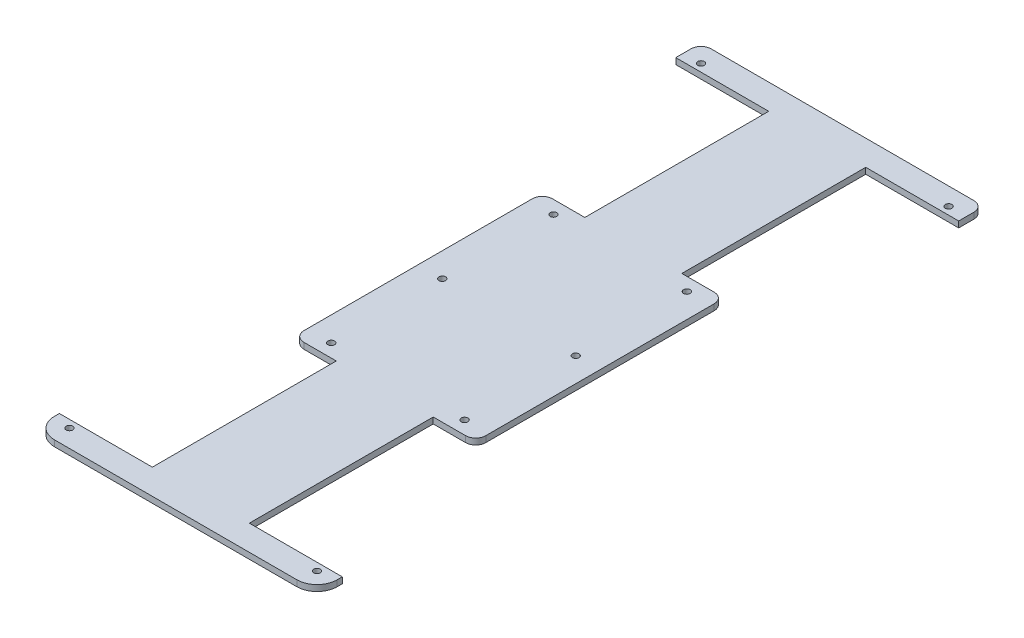
from build123d import *

# Parameters (mm, degrees)
BOSS_EXTRUDE1_DEPTH = 3
FILLET1_R           = 10
FILLET2_R           = 5
SKETCH2_R           = 1.65
CUT_EXTRUDE1_DEPTH  = 359.481519747
SKETCH3_R           = 1.65
CUT_EXTRUDE2_DEPTH  = 359.481519747
SKETCH4_R           = 1.65
CUT_EXTRUDE3_DEPTH  = 359.481519747


with BuildPart() as part:
    # Sketch1 → Boss-Extrude1 (new body)
    with BuildSketch(Plane(origin=(0, 0, 0), x_dir=(1, 0, 0), z_dir=(0, 1, 0))):
        Polygon((0, 0), (140, 0), (140, 12.5), (94, 12.5), (94, 103.5), (115, 103.5), (115, 226.5), (94, 226.5), (94, 317.5), (140, 317.5), (140, 330), (0, 330), (0, 317.5), (46, 317.5), (46, 226.5), (25, 226.5), (25, 103.5), (46, 103.5), (46, 12.5), (0, 12.5), align=None)
    extrude(amount=BOSS_EXTRUDE1_DEPTH)

    # Fillet1
    fillet1_edges = [part.edges().sort_by_distance(p)[0] for p in [
        (140, 1.5, 0),
        (0, 1.5, 0),
    ]]
    fillet(fillet1_edges, radius=FILLET1_R)

    # Fillet2
    fillet2_edges = [part.edges().sort_by_distance(p)[0] for p in [
        (0, 1.5, -330),
        (140, 1.5, -330),
        (115, 1.5, -226.5),
        (115, 1.5, -103.5),
        (25, 1.5, -103.5),
        (25, 1.5, -226.5),
    ]]
    fillet(fillet2_edges, radius=FILLET2_R)

    # Sketch2 → Cut-Extrude1 (cut, through all)
    with BuildSketch(Plane(origin=(0, 3, 0), x_dir=(1, 0, 0), z_dir=(0, 1, 0))):
        with Locations((37, 220)):
            Circle(SKETCH2_R)
        with Locations((37, 165)):
            Circle(SKETCH2_R)
        with Locations((37, 110)):
            Circle(SKETCH2_R)
        with Locations((103, 110)):
            Circle(SKETCH2_R)
        with Locations((103, 165)):
            Circle(SKETCH2_R)
        with Locations((103, 220)):
            Circle(SKETCH2_R)
    extrude(amount=-CUT_EXTRUDE1_DEPTH, mode=Mode.SUBTRACT)

    # Sketch3 → Cut-Extrude2 (cut, through all)
    with BuildSketch(Plane(origin=(0, 3, 0), x_dir=(1, 0, 0), z_dir=(0, 1, 0))):
        with Locations((8.75, 8.75)):
            Circle(SKETCH3_R)
        with Locations((131.25, 8.75)):
            Circle(SKETCH3_R)
    extrude(amount=-CUT_EXTRUDE2_DEPTH, mode=Mode.SUBTRACT)

    # Sketch4 → Cut-Extrude3 (cut, through all)
    with BuildSketch(Plane(origin=(0, 3, 0), x_dir=(1, 0, 0), z_dir=(0, 1, 0))):
        with Locations((8.75, 321.25)):
            Circle(SKETCH4_R)
        with Locations((131.25, 321.25)):
            Circle(SKETCH4_R)
    extrude(amount=-CUT_EXTRUDE3_DEPTH, mode=Mode.SUBTRACT)


solid = part.part
